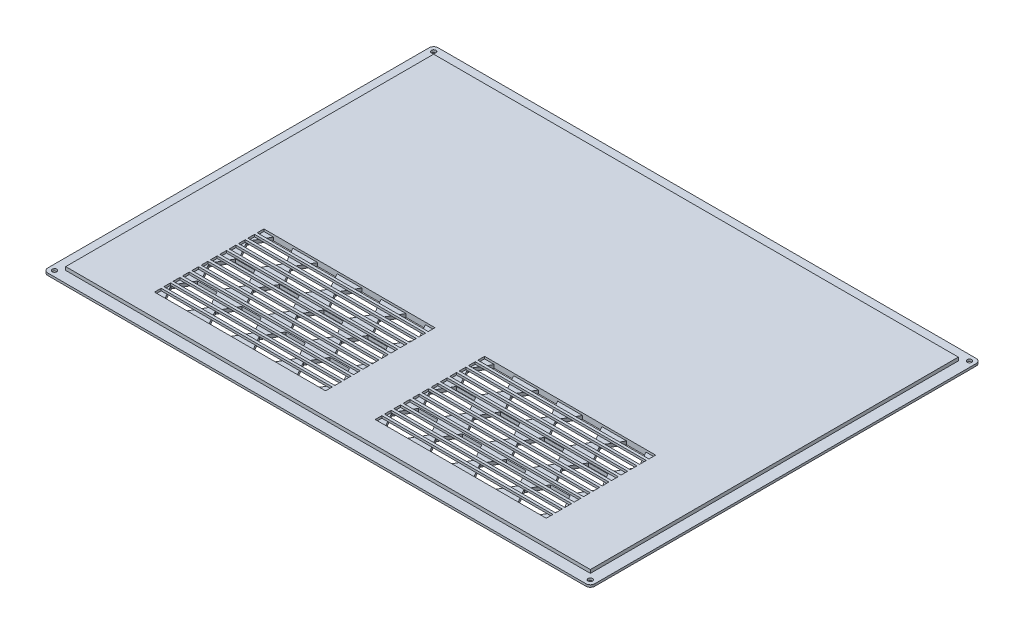
from build123d import *

# Parameters (mm, degrees)
SKETCH1_W                        = 245
SKETCH1_H                        = 174.8
BOSS_EXTRUDE1_DEPTH              = 1
SKETCH2_W                        = 235
SKETCH2_H                        = 164.8
BOSS_EXTRUDE2_DEPTH              = 1.5
FILLET1_R                        = 2
CUT_EXTRUDE4_DEPTH               = 1.5
M2_5X0_45_TAPPED_HOLE1_OUTLINE_R = 1.025
M2_5X0_45_TAPPED_HOLE1_DEPTH     = 1
SKETCH9_W                        = 76.624508076
SKETCH9_H                        = 3
CUT_EXTRUDE5_DEPTH               = 1


# Read off the part's stored shape, not the designer's step: M2.5x0.45 Tapped Hole1
with BuildPart() as part:
    # Sketch1 → Boss-Extrude1 (new body)
    with BuildSketch(Plane(origin=(0, 0, 0), x_dir=(1, 0, 0), z_dir=(0, 1, 0))):
        Rectangle(SKETCH1_W, SKETCH1_H)
    extrude(amount=BOSS_EXTRUDE1_DEPTH)

    # Sketch2 → Boss-Extrude2 (add)
    with BuildSketch(Plane(origin=(0, 1, 0), x_dir=(1, 0, 0), z_dir=(0, 1, 0))):
        Rectangle(SKETCH2_W, SKETCH2_H)
    extrude(amount=BOSS_EXTRUDE2_DEPTH)

    # Fillet1
    fillet1_edges = [part.edges().sort_by_distance(p)[0] for p in [
        (122.5, 0.5, 87.4),
        (-122.5, 0.5, 87.4),
        (-122.5, 0.5, -87.4),
        (122.5, 0.5, -87.4),
    ]]
    fillet(fillet1_edges, radius=FILLET1_R)

    # Sketch8 → Cut-Extrude4 (cut)
    with BuildSketch(Plane.XZ):
        Polygon((-94.509618943, 57.4), (-90.179491924, 64.9), (-94.509618943, 72.4), (-103.169872981, 72.4), (-107.5, 64.9), (-103.169872981, 57.4), align=None)
        Polygon((-63.633872981, 57.4), (-54.973618943, 57.4), (-50.643491924, 64.9), (-54.973618943, 72.4), (-63.633872981, 72.4), (-67.964, 64.9), align=None)
        Polygon((-87.732, 64.9), (-83.401872981, 57.4), (-74.741618943, 57.4), (-70.411491924, 64.9), (-74.741618943, 72.4), (-83.401872981, 72.4), align=None)
        Polygon((-4.329872981, 57.4), (4.330381057, 57.4), (8.660508076, 64.9), (4.330381057, 72.4), (-4.329872981, 72.4), (-8.66, 64.9), align=None)
        Polygon((-24.097872981, 57.4), (-15.437618943, 57.4), (-11.107491924, 64.9), (-15.437618943, 72.4), (-24.097872981, 72.4), (-28.428, 64.9), align=None)
        Polygon((-48.196, 64.9), (-43.865872981, 57.4), (-35.205618943, 57.4), (-30.875491924, 64.9), (-35.205618943, 72.4), (-43.865872981, 72.4), align=None)
        Polygon((35.206127019, 57.4), (43.866381057, 57.4), (48.196508076, 64.9), (43.866381057, 72.4), (35.206127019, 72.4), (30.876, 64.9), align=None)
        Polygon((15.438127019, 57.4), (24.098381057, 57.4), (28.428508076, 64.9), (24.098381057, 72.4), (15.438127019, 72.4), (11.108, 64.9), align=None)
        Polygon((94.510127019, 57.4), (103.170381057, 57.4), (107.500508076, 64.9), (103.170381057, 72.4), (94.510127019, 72.4), (90.18, 64.9), align=None)
        Polygon((74.742127019, 57.4), (83.402381057, 57.4), (87.732508076, 64.9), (83.402381057, 72.4), (74.742127019, 72.4), (70.412, 64.9), align=None)
        Polygon((63.634381057, 72.4), (54.974127019, 72.4), (50.644, 64.9), (54.974127019, 57.4), (63.634381057, 57.4), (67.964508076, 64.9), align=None)
        Polygon((-43.865872981, 40.4), (-35.205618943, 40.4), (-30.875491924, 47.9), (-35.205618943, 55.4), (-43.865872981, 55.4), (-48.196, 47.9), align=None)
        Polygon((-63.633872981, 40.4), (-54.973618943, 40.4), (-50.643491924, 47.9), (-54.973618943, 55.4), (-63.633872981, 55.4), (-67.964, 47.9), align=None)
        Polygon((-87.732, 47.9), (-83.401872981, 40.4), (-74.741618943, 40.4), (-70.411491924, 47.9), (-74.741618943, 55.4), (-83.401872981, 55.4), align=None)
        Polygon((-4.329872981, 40.4), (4.330381057, 40.4), (8.660508076, 47.9), (4.330381057, 55.4), (-4.329872981, 55.4), (-8.66, 47.9), align=None)
        Polygon((-24.097872981, 40.4), (-15.437618943, 40.4), (-11.107491924, 47.9), (-15.437618943, 55.4), (-24.097872981, 55.4), (-28.428, 47.9), align=None)
        Polygon((54.974127019, 40.4), (63.634381057, 40.4), (67.964508076, 47.9), (63.634381057, 55.4), (54.974127019, 55.4), (50.644, 47.9), align=None)
        Polygon((35.206127019, 40.4), (43.866381057, 40.4), (48.196508076, 47.9), (43.866381057, 55.4), (35.206127019, 55.4), (30.876, 47.9), align=None)
        Polygon((24.098381057, 55.4), (15.438127019, 55.4), (11.108, 47.9), (15.438127019, 40.4), (24.098381057, 40.4), (28.428508076, 47.9), align=None)
        Polygon((-83.401872981, 23.4), (-74.741618943, 23.4), (-70.411491924, 30.9), (-74.741618943, 38.4), (-83.401872981, 38.4), (-87.732, 30.9), align=None)
        Polygon((94.510127019, 40.4), (103.170381057, 40.4), (107.500508076, 47.9), (103.170381057, 55.4), (94.510127019, 55.4), (90.18, 47.9), align=None)
        Polygon((70.412, 47.9), (74.742127019, 40.4), (83.402381057, 40.4), (87.732508076, 47.9), (83.402381057, 55.4), (74.742127019, 55.4), align=None)
        Polygon((-43.865872981, 23.4), (-35.205618943, 23.4), (-30.875491924, 30.9), (-35.205618943, 38.4), (-43.865872981, 38.4), (-48.196, 30.9), align=None)
        Polygon((-63.633872981, 23.4), (-54.973618943, 23.4), (-50.643491924, 30.9), (-54.973618943, 38.4), (-63.633872981, 38.4), (-67.964, 30.9), align=None)
        Polygon((15.438127019, 23.4), (24.098381057, 23.4), (28.428508076, 30.9), (24.098381057, 38.4), (15.438127019, 38.4), (11.108, 30.9), align=None)
        Polygon((-4.329872981, 23.4), (4.330381057, 23.4), (8.660508076, 30.9), (4.330381057, 38.4), (-4.329872981, 38.4), (-8.66, 30.9), align=None)
        Polygon((-15.437618943, 38.4), (-24.097872981, 38.4), (-28.428, 30.9), (-24.097872981, 23.4), (-15.437618943, 23.4), (-11.107491924, 30.9), align=None)
        Polygon((74.742127019, 23.4), (83.402381057, 23.4), (87.732508076, 30.9), (83.402381057, 38.4), (74.742127019, 38.4), (70.412, 30.9), align=None)
        Polygon((54.974127019, 23.4), (63.634381057, 23.4), (67.964508076, 30.9), (63.634381057, 38.4), (54.974127019, 38.4), (50.644, 30.9), align=None)
        Polygon((30.876, 30.9), (35.206127019, 23.4), (43.866381057, 23.4), (48.196508076, 30.9), (43.866381057, 38.4), (35.206127019, 38.4), align=None)
        Polygon((-103.169872981, 40.4), (-94.509618943, 40.4), (-90.179491924, 47.9), (-94.509618943, 55.4), (-103.169872981, 55.4), (-107.5, 47.9), align=None)
        Polygon((94.510127019, 23.4), (103.170381057, 23.4), (107.500508076, 30.9), (103.170381057, 38.4), (94.510127019, 38.4), (90.18, 30.9), align=None)
        Polygon((-94.509618943, 38.4), (-103.169872981, 38.4), (-107.5, 30.9), (-103.169872981, 23.4), (-94.509618943, 23.4), (-90.179491924, 30.9), align=None)
    extrude(amount=-CUT_EXTRUDE4_DEPTH, mode=Mode.SUBTRACT)

    # M2.5x0.45 Tapped Hole1 outline → M2.5x0.45 Tapped Hole1 (cut)
    with BuildSketch(Plane(origin=(0, 0, 0), x_dir=(1, 0, 0), z_dir=(0, 1, 0))):
        with Locations((-120, -84.9)):
            Circle(M2_5X0_45_TAPPED_HOLE1_OUTLINE_R)
        with Locations((120, -84.9)):
            Circle(M2_5X0_45_TAPPED_HOLE1_OUTLINE_R)
        with Locations((120, 84.9)):
            Circle(M2_5X0_45_TAPPED_HOLE1_OUTLINE_R)
        with Locations((-120, 84.9)):
            Circle(M2_5X0_45_TAPPED_HOLE1_OUTLINE_R)
    extrude(amount=M2_5X0_45_TAPPED_HOLE1_DEPTH, mode=Mode.SUBTRACT)

    # Sketch9 → Cut-Extrude5 (cut)
    with BuildSketch(Plane(origin=(0, 2.5, 0), x_dir=(1, 0, 0), z_dir=(0, 1, 0))):
        with Locations((-49.419745962, -24.9)):
            Rectangle(SKETCH9_W, SKETCH9_H)
        with Locations((-49.419745962, -29.081819)):
            Rectangle(SKETCH9_W, SKETCH9_H)
        with Locations((-49.419745962, -45.809095)):
            Rectangle(SKETCH9_W, SKETCH9_H)
        with Locations((-49.419745962, -41.627276)):
            Rectangle(SKETCH9_W, SKETCH9_H)
        with Locations((-49.419745962, -37.445457)):
            Rectangle(SKETCH9_W, SKETCH9_H)
        with Locations((-49.419745962, -33.263638)):
            Rectangle(SKETCH9_W, SKETCH9_H)
        with Locations((-49.419745962, -62.536371)):
            Rectangle(SKETCH9_W, SKETCH9_H)
        with Locations((-49.419745962, -58.354552)):
            Rectangle(SKETCH9_W, SKETCH9_H)
        with Locations((-49.419745962, -54.172733)):
            Rectangle(SKETCH9_W, SKETCH9_H)
        with Locations((-49.419745962, -49.990914)):
            Rectangle(SKETCH9_W, SKETCH9_H)
        with Locations((-49.419745962, -70.900009)):
            Rectangle(SKETCH9_W, SKETCH9_H)
        with Locations((-49.419745962, -66.71819)):
            Rectangle(SKETCH9_W, SKETCH9_H)
    cut_extrude5 = extrude(amount=-CUT_EXTRUDE5_DEPTH, mode=Mode.SUBTRACT)

    # Mirror1: Cut-Extrude5 across plane
    add(cut_extrude5.mirror(Plane(origin=(0, 0, 0), x_dir=(0, 0, 1), z_dir=(1, 0, 0))), mode=Mode.SUBTRACT)


solid = part.part
